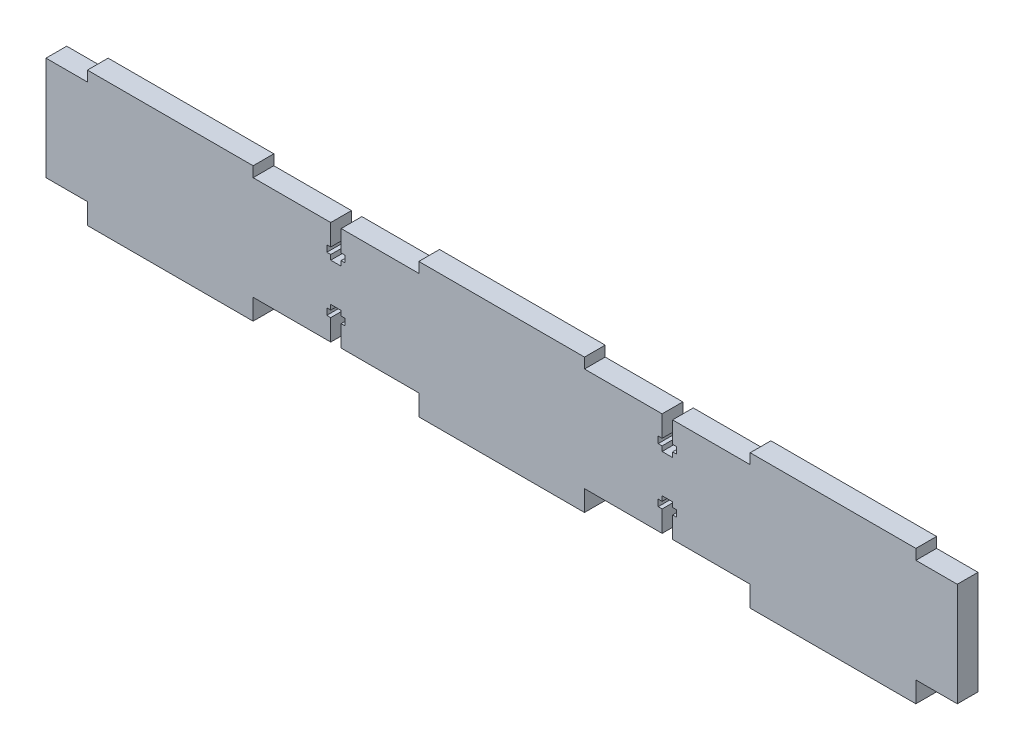
from build123d import *

# Parameters (mm, degrees)
BASEEXTRUDE_DEPTH = 6.35
SCREWCUTS_DEPTH   = 282.645944627


with BuildPart() as part:
    # Sketch1 → BaseExtrude (new body)
    with BuildSketch(Plane.XY):
        Polygon((0, 0), (12.7, 0), (12.7, -6.35), (63.5, -6.35), (63.5, 0), (114.3, 0), (114.3, -6.35), (165.1, -6.35), (165.1, 0), (215.9, 0), (215.9, -6.35), (266.7, -6.35), (266.7, 0), (279.4, 0), (279.4, 31.75), (266.7, 31.75), (266.7, 34.925), (215.9, 34.925), (215.9, 31.75), (165.1, 31.75), (165.1, 34.925), (114.3, 34.925), (114.3, 31.75), (63.5, 31.75), (63.5, 34.925), (12.7, 34.925), (12.7, 31.75), (0, 31.75), align=None)
    extrude(amount=BASEEXTRUDE_DEPTH)

    # Sketch2 → ScrewCuts (cut, through all)
    with BuildSketch(Plane.XY.offset(6.35)):
        Polygon((90.5, 31.75), (87.3, 31.75), (87.3, 25.25), (86.1, 25.25), (86.1, 23.25), (87.3, 23.25), (87.3, 21.75), (90.5, 21.75), (90.5, 23.25), (91.7, 23.25), (91.7, 25.25), (90.5, 25.25), align=None)
        Polygon((87.3, 8.5), (87.3, 10), (90.5, 10), (90.5, 8.5), (91.7, 8.5), (91.7, 6.5), (90.5, 6.5), (90.5, 0), (87.3, 0), (87.3, 6.5), (86.1, 6.5), (86.1, 8.5), align=None)
        Polygon((188.9, 0), (192.1, 0), (192.1, 6.5), (193.3, 6.5), (193.3, 8.5), (192.1, 8.5), (192.1, 10), (188.9, 10), (188.9, 8.5), (187.7, 8.5), (187.7, 6.5), (188.9, 6.5), align=None)
        Polygon((192.1, 23.25), (192.1, 21.75), (188.9, 21.75), (188.9, 23.25), (187.7, 23.25), (187.7, 25.25), (188.9, 25.25), (188.9, 31.75), (192.1, 31.75), (192.1, 25.25), (193.3, 25.25), (193.3, 23.25), align=None)
    extrude(amount=-SCREWCUTS_DEPTH, mode=Mode.SUBTRACT)


solid = part.part
